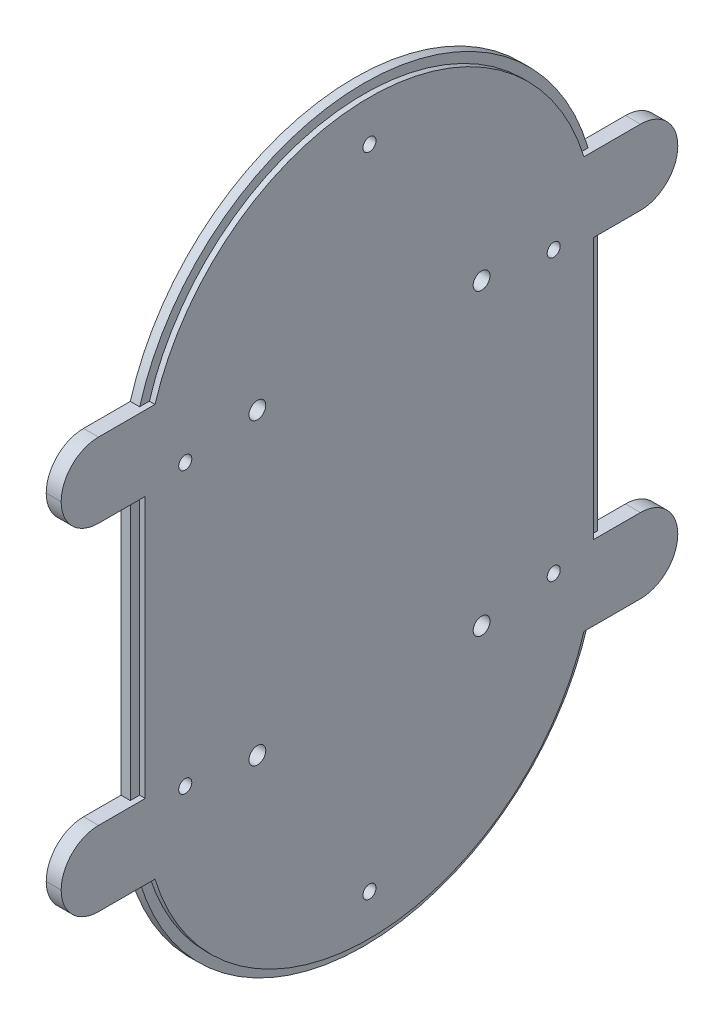
from build123d import *

# Parameters (mm, degrees)
BOSS_EXTRUDE1_DEPTH  = 2.5
BOSS_EXTRUDE2_DEPTH  = 1.5
BOSS_EXTRUDE3_REACH  = 178.185
SKETCH4_W            = 4
SKETCH4_H            = 20
FILLET1_R            = 10
FILLET1_OF_MIRROR2_R = 10
SKETCH6_R            = 2.25
CUT_EXTRUDE2_DEPTH   = 130.700616807
SKETCH7_R            = 1.75
CUT_EXTRUDE3_DEPTH   = 130.700616807


with BuildPart() as part:
    # Sketch1 → Boss-Extrude1 (new body)
    with BuildSketch(Plane(origin=(0, 0, 0), x_dir=(0, 0, -1), z_dir=(1, 0, 0))):
        with BuildLine():
            Line((-62.5, -37.5), (-62.5, 37.5))
            ThreePointArc((-62.5, 37.5), (0, 100), (62.5, 37.5))
            Line((62.5, 37.5), (62.5, -37.5))
            ThreePointArc((62.5, -37.5), (0, -100), (-62.5, -37.5))
        make_face()
    extrude(amount=BOSS_EXTRUDE1_DEPTH)

    # Sketch2 → Boss-Extrude2 (add)
    with BuildSketch(Plane(origin=(2.5, 0, 0), x_dir=(0, 0, -1), z_dir=(1, 0, 0))):
        with BuildLine():
            Line((-60, 37.5), (-60, -37.5))
            ThreePointArc((-60, -37.5), (0, -97.5), (60, -37.5))
            Line((60, -37.5), (60, 37.5))
            ThreePointArc((60, 37.5), (0, 97.5), (-60, 37.5))
        make_face()
    extrude(amount=BOSS_EXTRUDE2_DEPTH)

    # Sketch4 → Boss-Extrude3 (add, up to next)
    with BuildSketch(Plane(origin=(0, 0, -82.5), x_dir=(-1, 0, 0), z_dir=(0, 0, -1)), mode=Mode.PRIVATE) as boss_extrude3_sk1:
        with Locations((-2, 45)):
            Rectangle(SKETCH4_W, SKETCH4_H)
    boss_extrude3_tool1 = extrude(boss_extrude3_sk1.sketch, amount=-BOSS_EXTRUDE3_REACH, mode=Mode.PRIVATE) - part.part
    # Sketch4 → Boss-Extrude3 (add, up to next)
    with BuildSketch(Plane(origin=(0, 0, -82.5), x_dir=(-1, 0, 0), z_dir=(0, 0, -1)), mode=Mode.PRIVATE) as boss_extrude3_sk2:
        with Locations((-2, -45)):
            Rectangle(SKETCH4_W, SKETCH4_H)
    boss_extrude3_tool2 = extrude(boss_extrude3_sk2.sketch, amount=-BOSS_EXTRUDE3_REACH, mode=Mode.PRIVATE) - part.part
    boss_extrude3_1 = boss_extrude3_tool1.solids().sort_by_distance((2, 45, -82.5))[0]
    add(boss_extrude3_1)
    boss_extrude3_2 = boss_extrude3_tool2.solids().sort_by_distance((2, -45, -82.5))[0]
    add(boss_extrude3_2)
    boss_extrude3 = boss_extrude3_1 + boss_extrude3_2  # Boss-Extrude3 as one shape, for the pattern or mirror that repeats it

    # Fillet1
    fillet1_edges = [part.edges().sort_by_distance(p)[0] for p in [
        (2, -55, -82.5),
        (2, -35, -82.5),
        (2, 35, -82.5),
        (2, 55, -82.5),
    ]]
    fillet(fillet1_edges, radius=FILLET1_R - 0.0001)  # a hair under: the kernel refuses the full size

    # Mirror2: Boss-Extrude3 across plane
    add(boss_extrude3.mirror(Plane(origin=(0, 0, 0), x_dir=(1, 0, 0), z_dir=(0, 0, -1))))

    # Fillet1 of Mirror2
    fillet1_of_mirror2_edges = [part.edges().sort_by_distance(p)[0] for p in [
        (2, -55, 82.5),
        (2, -35, 82.5),
        (2, 35, 82.5),
        (2, 55, 82.5),
    ]]
    fillet(fillet1_of_mirror2_edges, radius=FILLET1_OF_MIRROR2_R - 0.0001)  # a hair under: the kernel refuses the full size

    # Sketch6 → Cut-Extrude2 (cut, through all)
    with BuildSketch(Plane(origin=(4, 0, 0), x_dir=(0, 0, -1), z_dir=(1, 0, 0))):
        with Locations((-30, 40)):
            Circle(SKETCH6_R)
        with Locations(Location((30, 40, 0), (0, 0, 180))):
            Circle(SKETCH6_R)
        with Locations((30, -40)):
            Circle(SKETCH6_R)
        with Locations(Location((-30, -40, 0), (0, 0, 180))):
            Circle(SKETCH6_R)
    extrude(amount=-CUT_EXTRUDE2_DEPTH, mode=Mode.SUBTRACT)

    # Sketch7 → Cut-Extrude3 (cut, through all)
    with BuildSketch(Plane(origin=(4, 0, 0), x_dir=(0, 0, -1), z_dir=(1, 0, 0))):
        with Locations((0, 86.58)):
            Circle(SKETCH7_R)
        with Locations((49.3, 37.5)):
            Circle(SKETCH7_R)
        with Locations(Location((-49.3, 37.5, 0), (0, 0, 180))):
            Circle(SKETCH7_R)
        with Locations(Location((49.3, -37.5, 0), (0, 0, 180))):
            Circle(SKETCH7_R)
        with Locations(Location((0, -86.58, 0), (0, 0, 180))):
            Circle(SKETCH7_R)
        with Locations((-49.3, -37.5)):
            Circle(SKETCH7_R)
    extrude(amount=-CUT_EXTRUDE3_DEPTH, mode=Mode.SUBTRACT)


solid = part.part
